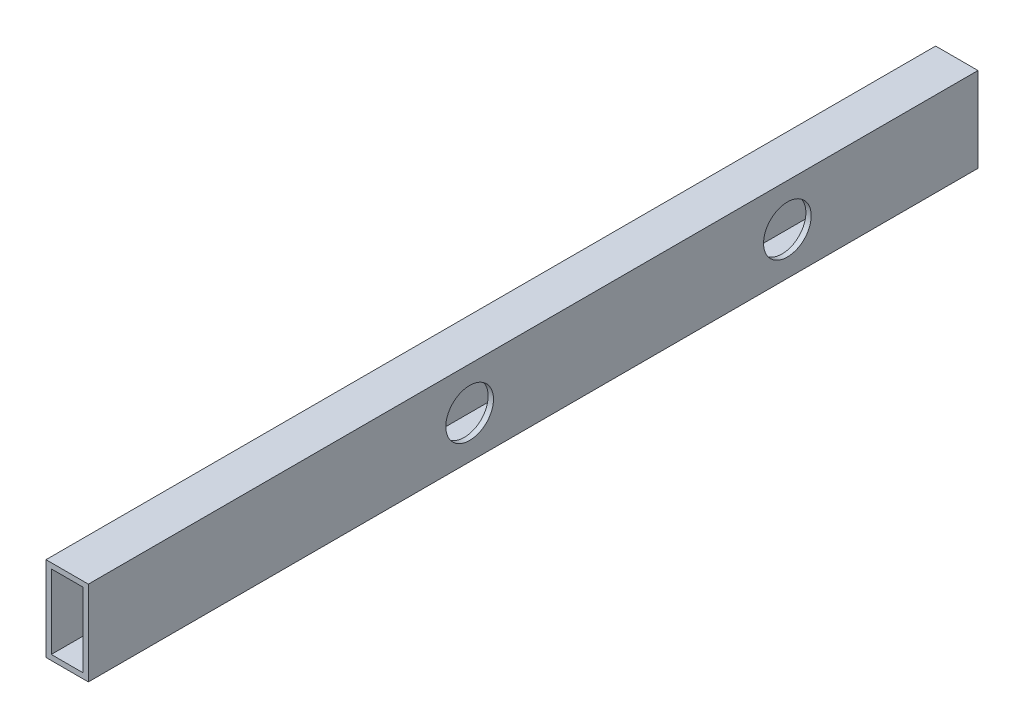
from build123d import *

# Parameters (mm, degrees)
SKETCH1_W           = 25.4
SKETCH1_H           = 50.8
SKETCH1_W_2         = 19.05
SKETCH1_H_2         = 44.45
EXTRUDE_THIN1_DEPTH = 533.4
SKETCH2_R           = 14.2875
CUT_EXTRUDE1_DEPTH  = 535.608155568


with BuildPart() as part:
    # Sketch1 → Extrude-Thin1 (new body)
    with BuildSketch(Plane.XY):
        Rectangle(SKETCH1_W, SKETCH1_H)
        Rectangle(SKETCH1_W_2, SKETCH1_H_2, mode=Mode.SUBTRACT)
    extrude(amount=EXTRUDE_THIN1_DEPTH)

    # Sketch2 → Cut-Extrude1 (cut, through all)
    with BuildSketch(Plane(origin=(12.7, 0, 0), x_dir=(0, 0, -1), z_dir=(1, 0, 0))):
        with Locations((-304.8, 0)):
            Circle(SKETCH2_R)
        with Locations((-114.3, 0)):
            Circle(SKETCH2_R)
    extrude(amount=-CUT_EXTRUDE1_DEPTH, mode=Mode.SUBTRACT)


solid = part.part
